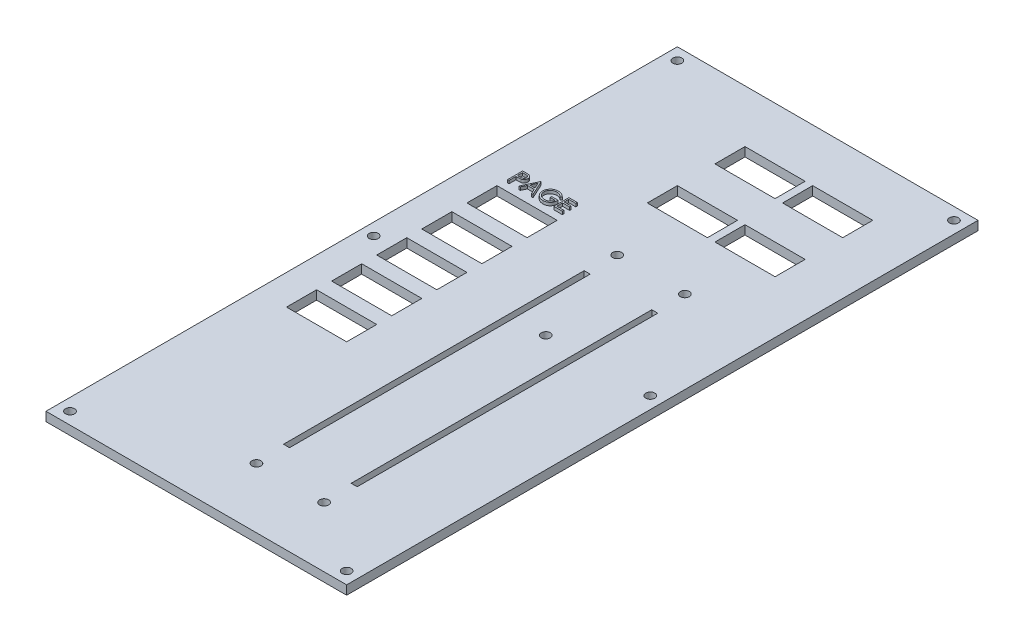
from build123d import *

# Parameters (mm, degrees)
SKETCH1_W            = 100
SKETCH1_H            = 210
BOSS_EXTRUDE1_DEPTH  = 3
CUT_EXTRUDE1_REACH   = 118.336
SKETCH3_R            = 1.5
SKETCH3_W            = 2
SKETCH3_H            = 100
LPATTERN1_COUNT      = 2
LPATTERN1_PITCH      = 22.5
CUT_EXTRUDE2_REACH   = 118.336
SKETCH4_W            = 20
SKETCH4_H            = 10
LPATTERN2_COUNT      = 2
LPATTERN2_PITCH      = 22.5
LPATTERN2_COUNT_DIR2 = 2
LPATTERN2_PITCH_DIR2 = 22.5
CUT_EXTRUDE3_REACH   = 118.336
SKETCH5_R            = 1.5
CUT_EXTRUDE4_REACH   = 118.336
SKETCH6_W            = 20
SKETCH6_H            = 10
LPATTERN3_COUNT      = 5
LPATTERN3_PITCH      = 15
CUT_EXTRUDE5_REACH   = 118.336
SKETCH7_R            = 1.5
CUT_EXTRUDE6_REACH   = 118.336
SKETCH8_R            = 1.5
BOSS_EXTRUDE2_DEPTH  = 1


with BuildPart() as part:
    # Sketch1 → Boss-Extrude1 (new body)
    with BuildSketch(Plane(origin=(0, 0, 0), x_dir=(1, 0, 0), z_dir=(0, 1, 0))):
        Rectangle(SKETCH1_W, SKETCH1_H)
    extrude(amount=BOSS_EXTRUDE1_DEPTH)

    # Sketch3 → Cut-Extrude1 (cut, up to next)
    with BuildSketch(Plane(origin=(0, 3, 0), x_dir=(1, 0, 0), z_dir=(0, 1, 0)), mode=Mode.PRIVATE) as cut_extrude1_sk1:
        with Locations((0, -85)):
            Circle(SKETCH3_R)
    cut_extrude1_tool1 = extrude(cut_extrude1_sk1.sketch, amount=-CUT_EXTRUDE1_REACH, mode=Mode.PRIVATE) & part.part
    # Sketch3 → Cut-Extrude1 (cut, up to next)
    with BuildSketch(Plane(origin=(0, 3, 0), x_dir=(1, 0, 0), z_dir=(0, 1, 0)), mode=Mode.PRIVATE) as cut_extrude1_sk2:
        with Locations((0, 35)):
            Circle(SKETCH3_R)
    cut_extrude1_tool2 = extrude(cut_extrude1_sk2.sketch, amount=-CUT_EXTRUDE1_REACH, mode=Mode.PRIVATE) & part.part
    # Sketch3 → Cut-Extrude1 (cut, up to next)
    with BuildSketch(Plane(origin=(0, 3, 0), x_dir=(1, 0, 0), z_dir=(0, 1, 0)), mode=Mode.PRIVATE) as cut_extrude1_sk3:
        with Locations((0, -25)):
            Rectangle(SKETCH3_W, SKETCH3_H)
    cut_extrude1_tool3 = extrude(cut_extrude1_sk3.sketch, amount=-CUT_EXTRUDE1_REACH, mode=Mode.PRIVATE) & part.part
    cut_extrude1_1 = cut_extrude1_tool1.solids().sort_by_distance((0, 3, 85))[0]
    add(cut_extrude1_1, mode=Mode.SUBTRACT)
    cut_extrude1_2 = cut_extrude1_tool2.solids().sort_by_distance((0, 3, -35))[0]
    add(cut_extrude1_2, mode=Mode.SUBTRACT)
    cut_extrude1_3 = cut_extrude1_tool3.solids().sort_by_distance((0, 3, 25))[0]
    add(cut_extrude1_3, mode=Mode.SUBTRACT)
    cut_extrude1 = cut_extrude1_1 + cut_extrude1_2 + cut_extrude1_3  # Cut-Extrude1 as one shape, for the pattern or mirror that repeats it

    # LPattern1: Cut-Extrude1 ×2
    with Locations(*[(i * LPATTERN1_PITCH, 0, 0) for i in range(1, LPATTERN1_COUNT)]):
        add(cut_extrude1, mode=Mode.SUBTRACT)

    # Sketch4 → Cut-Extrude2 (cut, up to next)
    with BuildSketch(Plane(origin=(0, 3, 0), x_dir=(1, 0, 0), z_dir=(0, 1, 0)), mode=Mode.PRIVATE) as cut_extrude2_sk1:
        with Locations((0, 60)):
            Rectangle(SKETCH4_W, SKETCH4_H)
    cut_extrude2_tool1 = extrude(cut_extrude2_sk1.sketch, amount=-CUT_EXTRUDE2_REACH, mode=Mode.PRIVATE) & part.part
    cut_extrude2 = cut_extrude2_tool1.solids().sort_by_distance((0, 3, -60))[0]
    add(cut_extrude2, mode=Mode.SUBTRACT)

    # LPattern2: Cut-Extrude2 2 × 2
    with Locations(*[(i * LPATTERN2_PITCH, 0, -j * LPATTERN2_PITCH_DIR2) for i in range(LPATTERN2_COUNT) for j in range(LPATTERN2_COUNT_DIR2) if (i, j) != (0, 0)]):
        add(cut_extrude2, mode=Mode.SUBTRACT)

    # Sketch5 → Cut-Extrude3 (cut, up to next)
    with BuildSketch(Plane(origin=(0, 3, 0), x_dir=(1, 0, 0), z_dir=(0, 1, 0)), mode=Mode.PRIVATE) as cut_extrude3_sk1:
        with Locations((-46, 101)):
            Circle(SKETCH5_R)
    cut_extrude3_tool1 = extrude(cut_extrude3_sk1.sketch, amount=-CUT_EXTRUDE3_REACH, mode=Mode.PRIVATE) & part.part
    # Sketch5 → Cut-Extrude3 (cut, up to next)
    with BuildSketch(Plane(origin=(0, 3, 0), x_dir=(1, 0, 0), z_dir=(0, 1, 0)), mode=Mode.PRIVATE) as cut_extrude3_sk2:
        with Locations((46, 101)):
            Circle(SKETCH5_R)
    cut_extrude3_tool2 = extrude(cut_extrude3_sk2.sketch, amount=-CUT_EXTRUDE3_REACH, mode=Mode.PRIVATE) & part.part
    # Sketch5 → Cut-Extrude3 (cut, up to next)
    with BuildSketch(Plane(origin=(0, 3, 0), x_dir=(1, 0, 0), z_dir=(0, 1, 0)), mode=Mode.PRIVATE) as cut_extrude3_sk3:
        with Locations((46, -101)):
            Circle(SKETCH5_R)
    cut_extrude3_tool3 = extrude(cut_extrude3_sk3.sketch, amount=-CUT_EXTRUDE3_REACH, mode=Mode.PRIVATE) & part.part
    # Sketch5 → Cut-Extrude3 (cut, up to next)
    with BuildSketch(Plane(origin=(0, 3, 0), x_dir=(1, 0, 0), z_dir=(0, 1, 0)), mode=Mode.PRIVATE) as cut_extrude3_sk4:
        with Locations((-46, -101)):
            Circle(SKETCH5_R)
    cut_extrude3_tool4 = extrude(cut_extrude3_sk4.sketch, amount=-CUT_EXTRUDE3_REACH, mode=Mode.PRIVATE) & part.part
    # Sketch5 → Cut-Extrude3 (cut, up to next)
    with BuildSketch(Plane(origin=(0, 3, 0), x_dir=(1, 0, 0), z_dir=(0, 1, 0)), mode=Mode.PRIVATE) as cut_extrude3_sk5:
        with Locations((11.25, 0)):
            Circle(SKETCH5_R)
    cut_extrude3_tool5 = extrude(cut_extrude3_sk5.sketch, amount=-CUT_EXTRUDE3_REACH, mode=Mode.PRIVATE) & part.part
    add(cut_extrude3_tool1.solids().sort_by_distance((-46, 3, -101))[0], mode=Mode.SUBTRACT)
    add(cut_extrude3_tool2.solids().sort_by_distance((46, 3, -101))[0], mode=Mode.SUBTRACT)
    add(cut_extrude3_tool3.solids().sort_by_distance((46, 3, 101))[0], mode=Mode.SUBTRACT)
    add(cut_extrude3_tool4.solids().sort_by_distance((-46, 3, 101))[0], mode=Mode.SUBTRACT)
    add(cut_extrude3_tool5.solids().sort_by_distance((11.25, 3, 0))[0], mode=Mode.SUBTRACT)

    # Sketch6 → Cut-Extrude4 (cut, up to next)
    with BuildSketch(Plane(origin=(0, 3, 0), x_dir=(1, 0, 0), z_dir=(0, 1, 0)), mode=Mode.PRIVATE) as cut_extrude4_sk1:
        with Locations((-30, 30)):
            Rectangle(SKETCH6_W, SKETCH6_H)
    cut_extrude4_tool1 = extrude(cut_extrude4_sk1.sketch, amount=-CUT_EXTRUDE4_REACH, mode=Mode.PRIVATE) & part.part
    cut_extrude4 = cut_extrude4_tool1.solids().sort_by_distance((-30, 3, -30))[0]
    add(cut_extrude4, mode=Mode.SUBTRACT)

    # LPattern3: Cut-Extrude4 ×5
    with Locations(*[(0, 0, i * LPATTERN3_PITCH) for i in range(1, LPATTERN3_COUNT)]):
        add(cut_extrude4, mode=Mode.SUBTRACT)

    # Sketch7 → Cut-Extrude5 (cut, up to next)
    with BuildSketch(Plane(origin=(0, 3, 0), x_dir=(1, 0, 0), z_dir=(0, 1, 0)), mode=Mode.PRIVATE) as cut_extrude5_sk1:
        with Locations((-46, 0)):
            Circle(SKETCH7_R)
    cut_extrude5_tool1 = extrude(cut_extrude5_sk1.sketch, amount=-CUT_EXTRUDE5_REACH, mode=Mode.PRIVATE) & part.part
    add(cut_extrude5_tool1.solids().sort_by_distance((-46, 3, 0))[0], mode=Mode.SUBTRACT)

    # Sketch8 → Cut-Extrude6 (cut, up to next)
    with BuildSketch(Plane(origin=(0, 3, 0), x_dir=(1, 0, 0), z_dir=(0, 1, 0)), mode=Mode.PRIVATE) as cut_extrude6_sk1:
        with Locations((46, 0)):
            Circle(SKETCH8_R)
    cut_extrude6_tool1 = extrude(cut_extrude6_sk1.sketch, amount=-CUT_EXTRUDE6_REACH, mode=Mode.PRIVATE) & part.part
    add(cut_extrude6_tool1.solids().sort_by_distance((46, 3, 0))[0], mode=Mode.SUBTRACT)

    # Sketch10 → Boss-Extrude2 (add)
    # profile 1 of 4: a face of its own
    with BuildSketch(Plane(origin=(0, 3, 0), x_dir=(1, 0, 0), z_dir=(0, 1, 0))):
        with BuildLine():
            Line((-38.958974359, 42.5), (-37.978405449, 42.5))
            add(Edge.make_bspline(
                [(-37.978405449, 42.5), (-37.910961297, 42.499925863), (-37.781735307, 42.499783812), (-37.596428085, 42.495477032), (-37.428128468, 42.489724615), (-37.277199353, 42.481750482), (-37.143176355, 42.472326781), (-37.026665927, 42.459109582), (-36.926752276, 42.44530916), (-36.866885919, 42.431278579), (-36.839583333, 42.424879808)],
                knots=[0, 0, 0, 0, 1.415646017, 2.712440637, 3.8905458, 4.950247383, 5.884950622, 6.709939814, 7.411656543, 8, 8, 8, 8], degree=3))
            add(Edge.make_bspline(
                [(-36.839583333, 42.424879808), (-36.805021142, 42.415419879), (-36.736711175, 42.396722934), (-36.638281113, 42.359274758), (-36.544632763, 42.314871665), (-36.455444822, 42.264266036), (-36.371813275, 42.205286659), (-36.292490359, 42.140324348), (-36.218176101, 42.06787925), (-36.149288399, 41.988763907), (-36.086024402, 41.904306464), (-36.031553427, 41.813246136), (-35.985943102, 41.717115703), (-35.946824143, 41.615982029), (-35.918669208, 41.508995853), (-35.897459352, 41.39690055), (-35.883997026, 41.279708135), (-35.882707652, 41.19962261), (-35.882051282, 41.158854167)],
                knots=[0, 0, 0, 0, 0.999701418, 1.975846123, 2.934577507, 3.890451536, 4.834027766, 5.787354733, 6.749476667, 7.726910423, 8.712836071, 9.690891519, 10.682875813, 11.679750201, 12.712814741, 13.765529915, 14.8625177, 16, 16, 16, 16], degree=3))
            add(Edge.make_bspline(
                [(-35.882051282, 41.158854167), (-35.882653317, 41.117743057), (-35.88383124, 41.037306394), (-35.897968791, 40.919630982), (-35.917011922, 40.807176139), (-35.946293425, 40.70019121), (-35.984644386, 40.599311538), (-36.029633033, 40.502995492), (-36.08389522, 40.412881675), (-36.146244976, 40.328642936), (-36.215604397, 40.250200204), (-36.291680023, 40.178121926), (-36.374164726, 40.112830014), (-36.462796366, 40.054178095), (-36.558439008, 40.003526267), (-36.659642084, 39.958158688), (-36.767285251, 39.920057173), (-36.841774556, 39.900014228), (-36.879647436, 39.889823718)],
                knots=[0, 0, 0, 0, 1.121902311, 2.195077645, 3.232258892, 4.234102512, 5.217864754, 6.176164875, 7.132989551, 8.084763148, 9.034132444, 9.988522005, 10.94243251, 11.903244335, 12.886203696, 13.894208494, 14.929344452, 16, 16, 16, 16], degree=3))
            add(Edge.make_bspline(
                [(-36.879647436, 39.889823718), (-36.910972199, 39.883162316), (-36.979622238, 39.868563468), (-37.09268327, 39.852265672), (-37.224319535, 39.838354814), (-37.374351364, 39.827924617), (-37.542644085, 39.81899552), (-37.729288738, 39.811898243), (-37.934651706, 39.807998451), (-38.07789634, 39.807797319), (-38.152684295, 39.807692308)],
                knots=[0, 0, 0, 0, 0.601384939, 1.31797006, 2.144135048, 3.087295005, 4.142315834, 5.309527816, 6.595305764, 8, 8, 8, 8], degree=3))
            Line((-38.152684295, 39.807692308), (-38.51025641, 39.807692308))
            Line((-38.51025641, 39.807692308), (-38.51025641, 37.5))
            Line((-38.51025641, 37.5), (-38.958974359, 37.5))
            Line((-38.958974359, 37.5), (-38.958974359, 42.5))
        make_face()
        with BuildLine():
            Line((-38.51025641, 41.987179487), (-38.51025641, 40.320512821))
            Line((-38.51025641, 40.320512821), (-37.634855769, 40.309495192))
            add(Edge.make_bspline(
                [(-37.634855769, 40.309495192), (-37.592113018, 40.309473101), (-37.509599018, 40.309430456), (-37.390404414, 40.315123632), (-37.279819717, 40.321695821), (-37.17818461, 40.331318569), (-37.085453275, 40.344920366), (-37.001471091, 40.35865142), (-36.926889258, 40.378516224), (-36.839604684, 40.405263465), (-36.742342759, 40.450881488), (-36.636531975, 40.517095616), (-36.546859709, 40.601496628), (-36.469262142, 40.69639353), (-36.407682317, 40.801963715), (-36.362602328, 40.914919339), (-36.33611496, 41.034101981), (-36.332563255, 41.115656465), (-36.330769231, 41.156850962)],
                knots=[0, 0, 0, 0, 1.160613943, 2.240541288, 3.23993089, 4.169200891, 5.011653406, 5.7853311, 6.478053781, 7.106038997, 8.262395093, 9.384106736, 10.481365981, 11.59014053, 12.70357646, 13.786202915, 14.881775077, 16, 16, 16, 16], degree=3))
            add(Edge.make_bspline(
                [(-36.330769231, 41.156850962), (-36.332573011, 41.197048838), (-36.336158704, 41.276957241), (-36.362809937, 41.394069756), (-36.407594671, 41.505835048), (-36.469675521, 41.610082313), (-36.545019992, 41.704637747), (-36.632590482, 41.7867765), (-36.732180856, 41.852807504), (-36.824821186, 41.895426478), (-36.907108594, 41.9214483), (-36.978582823, 41.939655215), (-37.059283786, 41.954191795), (-37.149237757, 41.965962513), (-37.24774752, 41.976038887), (-37.355659398, 41.982875997), (-37.472564603, 41.986878077), (-37.553722561, 41.987076585), (-37.595793269, 41.987179487)],
                knots=[0, 0, 0, 0, 1.120700087, 2.227813068, 3.331159281, 4.466773991, 5.599788987, 6.693661531, 7.80175334, 8.91857717, 9.525282508, 10.207424825, 10.974604443, 11.810962634, 12.737642355, 13.736264703, 14.826523623, 16, 16, 16, 16], degree=3))
            Line((-37.595793269, 41.987179487), (-38.51025641, 41.987179487))
        make_face(mode=Mode.SUBTRACT)
    # profile 2 of 4: a face of its own
    with BuildSketch(Plane(origin=(0, 3, 0), x_dir=(1, 0, 0), z_dir=(0, 1, 0))):
        Polygon((-32.805128205, 42.5), (-30.497435897, 37.5), (-30.985216346, 37.5), (-31.724399038, 39.102564103), (-33.991025641, 39.102564103), (-34.751241987, 37.5), (-35.241025641, 37.5), (-32.869230769, 42.5), align=None)
        Polygon((-32.8421875, 41.525440705), (-33.747636218, 39.615384615), (-31.960777244, 39.615384615), align=None, mode=Mode.SUBTRACT)
    # profile 3 of 4: a face of its own
    with BuildSketch(Plane(origin=(0, 3, 0), x_dir=(1, 0, 0), z_dir=(0, 1, 0))):
        with BuildLine():
            Line((-24.920512821, 41.646634615), (-25.305128205, 41.282051282))
            add(Edge.make_bspline(
                [(-25.305128205, 41.282051282), (-25.374726617, 41.347523943), (-25.512263826, 41.476908033), (-25.736492744, 41.644780884), (-25.970440793, 41.788589598), (-26.212887217, 41.905598507), (-26.457828008, 41.998959594), (-26.702011974, 42.065428365), (-26.942934405, 42.107817705), (-27.103173288, 42.112886804), (-27.18213141, 42.115384615)],
                knots=[0, 0, 0, 0, 1.08915593, 2.152340314, 3.188132944, 4.216796309, 5.218260357, 6.173443236, 7.099959455, 8, 8, 8, 8], degree=3))
            add(Edge.make_bspline(
                [(-27.18213141, 42.115384615), (-27.230580982, 42.11479375), (-27.327354468, 42.113613551), (-27.471100103, 42.098550386), (-27.613338155, 42.076886295), (-27.753800119, 42.045540755), (-27.8927591, 42.005813528), (-28.029731803, 41.956120009), (-28.164973738, 41.898183945), (-28.297210997, 41.831237554), (-28.425411716, 41.757694917), (-28.54649291, 41.676197001), (-28.661226337, 41.589355873), (-28.767455516, 41.494997331), (-28.865791497, 41.393976095), (-28.958574886, 41.288171372), (-29.042542451, 41.174692488), (-29.118386972, 41.055627308), (-29.186046427, 40.933067038), (-29.245773075, 40.808191338), (-29.295911773, 40.681414403), (-29.335582423, 40.55257715), (-29.368311929, 40.422676307), (-29.391337082, 40.29081242), (-29.404318113, 40.156844298), (-29.406563513, 40.067133929), (-29.407692308, 40.022035256)],
                knots=[0, 0, 0, 0, 1.02818874, 2.053710826, 3.065248034, 4.081641283, 5.106893873, 6.131558223, 7.173050175, 8.228653731, 9.27666206, 10.308777013, 11.325269123, 12.329503258, 13.32196095, 14.316845687, 15.314881793, 16.315733098, 17.311955233, 18.285320748, 19.252783886, 20.203351036, 21.145449891, 22.095197417, 23.042428769, 24, 24, 24, 24], degree=3))
            add(Edge.make_bspline(
                [(-29.407692308, 40.022035256), (-29.40661271, 39.975934089), (-29.404456463, 39.883857641), (-29.390656007, 39.746437537), (-29.365044235, 39.611058391), (-29.33080465, 39.477275344), (-29.287974914, 39.344859275), (-29.234585391, 39.214384261), (-29.171348819, 39.085855131), (-29.098153744, 38.960429964), (-29.017887739, 38.838254216), (-28.927969052, 38.723169185), (-28.832453933, 38.61364236), (-28.727862648, 38.512105555), (-28.617549016, 38.415842846), (-28.498217193, 38.327506386), (-28.372213678, 38.245394639), (-28.239346232, 38.170542468), (-28.101056543, 38.103673131), (-27.959261182, 38.044210423), (-27.813507159, 37.995239941), (-27.66456046, 37.955328364), (-27.512598643, 37.922613653), (-27.356850354, 37.901567253), (-27.19846077, 37.886294637), (-27.091691296, 37.885177966), (-27.037900641, 37.884615385)],
                knots=[0, 0, 0, 0, 0.93586088, 1.869166235, 2.799637598, 3.729985548, 4.670839027, 5.622275134, 6.589130586, 7.576015415, 8.568469353, 9.55398029, 10.53834874, 11.515998671, 12.510579167, 13.508179873, 14.527009472, 15.561807829, 16.601455013, 17.643573243, 18.680854198, 19.719860599, 20.772568776, 21.833555941, 22.908541556, 24, 24, 24, 24], degree=3))
            add(Edge.make_bspline(
                [(-27.037900641, 37.884615385), (-26.973074431, 37.885970494), (-26.845777635, 37.88863147), (-26.658654145, 37.909346169), (-26.478935473, 37.941698732), (-26.307126611, 37.989078584), (-26.14302801, 38.049512406), (-25.986038094, 38.122362958), (-25.837392867, 38.210424471), (-25.696645476, 38.309815709), (-25.566992354, 38.420551184), (-25.450057891, 38.540043263), (-25.347707192, 38.66771193), (-25.258414765, 38.802805237), (-25.184545258, 38.946441387), (-25.123912694, 39.097916477), (-25.077436563, 39.257298637), (-25.058358028, 39.367429539), (-25.048717949, 39.423076923)],
                knots=[0, 0, 0, 0, 1.13008108, 2.219097802, 3.278683437, 4.311054135, 5.322181354, 6.324827112, 7.324222904, 8.330512327, 9.32562643, 10.293043162, 11.24128371, 12.174520618, 13.111833804, 14.052305215, 15.015860969, 16, 16, 16, 16], degree=3))
            Line((-25.048717949, 39.423076923), (-26.715384615, 39.423076923))
            Line((-26.715384615, 39.423076923), (-26.715384615, 39.935897436))
            Line((-26.715384615, 39.935897436), (-24.6, 39.935897436))
            add(Edge.make_bspline(
                [(-24.6, 39.935897436), (-24.602436926, 39.840315309), (-24.607206431, 39.653243821), (-24.640662025, 39.380429148), (-24.694685614, 39.122755301), (-24.768486059, 38.879950912), (-24.864022174, 38.652360066), (-24.980268643, 38.439751685), (-25.119085959, 38.243499284), (-25.275529447, 38.062000708), (-25.451100815, 37.900101833), (-25.641055987, 37.757807636), (-25.845708799, 37.637946757), (-26.064865666, 37.540431525), (-26.297809143, 37.464325818), (-26.545078257, 37.410366423), (-26.806337686, 37.378037904), (-26.985390082, 37.373907362), (-27.076963141, 37.371794872)],
                knots=[0, 0, 0, 0, 1.140356446, 2.231883559, 3.274166699, 4.278491846, 5.25512956, 6.21435461, 7.1637429, 8.11826594, 9.068280886, 10.0076534, 10.945064095, 11.891975133, 12.864533718, 13.863980011, 14.907571808, 16, 16, 16, 16], degree=3))
            add(Edge.make_bspline(
                [(-27.076963141, 37.371794872), (-27.133406192, 37.372607902), (-27.244730078, 37.37421146), (-27.40914569, 37.385607671), (-27.569028005, 37.403151351), (-27.724353732, 37.429644385), (-27.875694221, 37.46209389), (-28.022293628, 37.503646346), (-28.164710402, 37.551744488), (-28.303164668, 37.606452593), (-28.436399734, 37.669840674), (-28.565009044, 37.740283016), (-28.68970351, 37.817416388), (-28.809633745, 37.902574739), (-28.925424633, 37.995121111), (-29.036329553, 38.095240995), (-29.142969378, 38.202628309), (-29.209770041, 38.278884037), (-29.243429487, 38.317307692)],
                knots=[0, 0, 0, 0, 1.107784379, 2.184907829, 3.233506516, 4.263428166, 5.276301166, 6.270063455, 7.25232949, 8.225834625, 9.190232166, 10.146266622, 11.1027726, 12.066435141, 13.031522626, 14.010570082, 14.99756817, 16, 16, 16, 16], degree=3))
            add(Edge.make_bspline(
                [(-29.243429487, 38.317307692), (-29.292266533, 38.378265768), (-29.389129979, 38.499170078), (-29.51381306, 38.692884285), (-29.620100779, 38.893458371), (-29.706340525, 39.101450697), (-29.773680648, 39.316666715), (-29.821975295, 39.538831417), (-29.850271422, 39.768230889), (-29.854347904, 39.923466981), (-29.856410256, 40.002003205)],
                knots=[0, 0, 0, 0, 1.023165419, 2.029347347, 3.013907458, 3.994755782, 4.975994455, 5.96558838, 6.970761222, 8, 8, 8, 8], degree=3))
            add(Edge.make_bspline(
                [(-29.856410256, 40.002003205), (-29.855649916, 40.060812138), (-29.854138899, 40.177682577), (-29.835816733, 40.351193016), (-29.809528993, 40.521622576), (-29.770890344, 40.688831942), (-29.722181394, 40.852932788), (-29.6613907, 41.014001308), (-29.590612277, 41.172132553), (-29.508347283, 41.326238078), (-29.416798055, 41.474272954), (-29.317440597, 41.615641244), (-29.208864026, 41.74776848), (-29.092841455, 41.872327978), (-28.967988612, 41.987754902), (-28.835475149, 42.095117917), (-28.695198945, 42.19456104), (-28.546718688, 42.284517946), (-28.392250567, 42.365323118), (-28.232164851, 42.43616485), (-28.066510407, 42.494712443), (-27.896528296, 42.544389271), (-27.720931866, 42.581125186), (-27.540995385, 42.607766251), (-27.355780939, 42.625995679), (-27.230586612, 42.627461759), (-27.167107372, 42.628205128)],
                knots=[0, 0, 0, 0, 1.008945113, 2.00506715, 2.99143336, 3.967273523, 4.948097931, 5.927297278, 6.919902385, 7.919676788, 8.923139349, 9.905703106, 10.883022732, 11.856032218, 12.825136022, 13.798837087, 14.781400844, 15.773989409, 16.776158564, 17.77167057, 18.775803737, 19.789618931, 20.80898985, 21.851988756, 22.910860228, 24, 24, 24, 24], degree=3))
            add(Edge.make_bspline(
                [(-27.167107372, 42.628205128), (-27.115338452, 42.627377283), (-27.012686768, 42.625735763), (-26.859935722, 42.614357694), (-26.709545701, 42.596323578), (-26.561293716, 42.571713883), (-26.415684621, 42.538194325), (-26.272303613, 42.49808249), (-26.130942847, 42.451379886), (-25.992045349, 42.395681534), (-25.854677183, 42.33246207), (-25.718074554, 42.261300038), (-25.582704202, 42.180978603), (-25.448331372, 42.091259267), (-25.314108717, 41.993682955), (-25.182159228, 41.885458922), (-25.049297879, 41.770854985), (-24.963866716, 41.688451865), (-24.920512821, 41.646634615)],
                knots=[0, 0, 0, 0, 0.985871117, 1.954866573, 2.915460327, 3.869826059, 4.81536089, 5.759505086, 6.70452669, 7.649098992, 8.607881297, 9.583363685, 10.581137262, 11.603961102, 12.659522466, 13.73993555, 14.853081303, 16, 16, 16, 16], degree=3))
        make_face()
    # profile 4 of 4: a face of its own
    with BuildSketch(Plane(origin=(0, 3, 0), x_dir=(1, 0, 0), z_dir=(0, 1, 0))):
        Polygon((-23.574358974, 42.5), (-20.753846154, 42.5), (-20.753846154, 41.987179487), (-23.125641026, 41.987179487), (-23.125641026, 40.448717949), (-20.753846154, 40.448717949), (-20.753846154, 39.935897436), (-23.125641026, 39.935897436), (-23.125641026, 38.012820513), (-20.753846154, 38.012820513), (-20.753846154, 37.5), (-23.574358974, 37.5), align=None)
    extrude(amount=BOSS_EXTRUDE2_DEPTH)


solid = part.part
